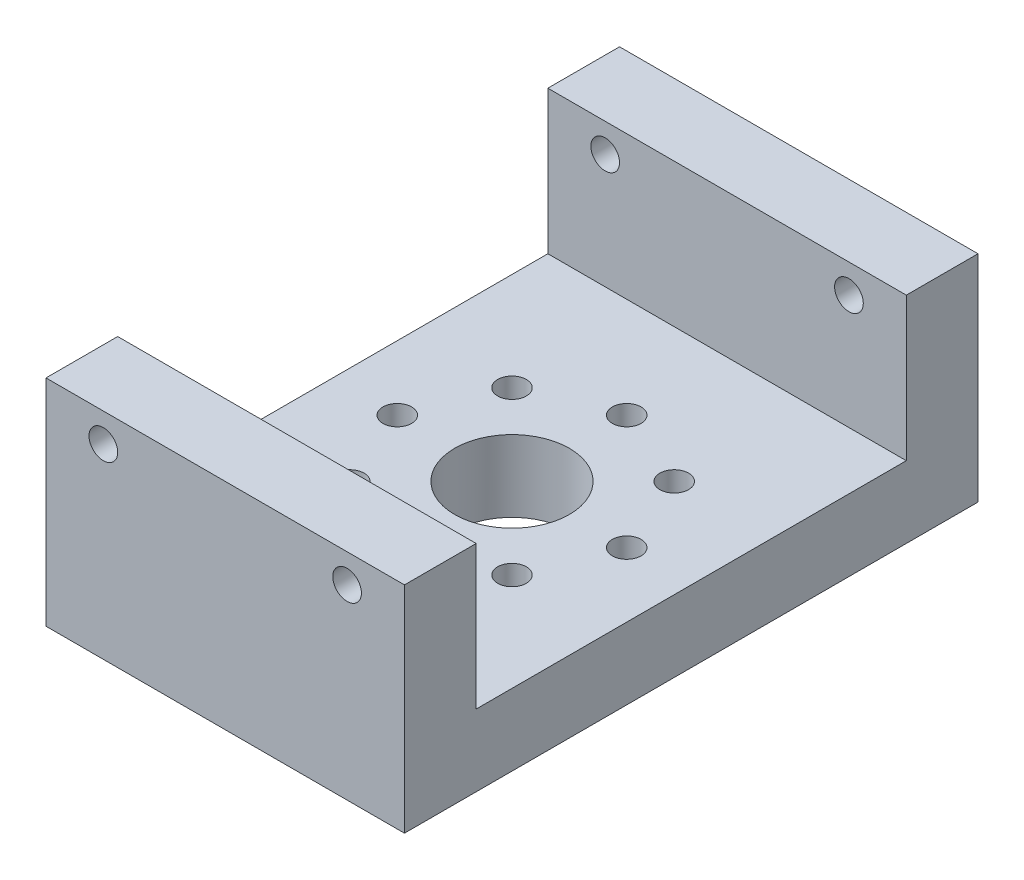
from build123d import *

# Parameters (mm, degrees)
SKETCH1_W           = 25
SKETCH1_H           = 40
BOSS_EXTRUDE1_DEPTH = 5
SKETCH5_W           = 25
SKETCH5_H           = 5
BOSS_EXTRUDE2_DEPTH = 10
SKETCH6_R           = 1
CUT_EXTRUDE3_DEPTH  = 45.511234537
SKETCH7_R           = 4
SKETCH7_R_2         = 1
CUT_EXTRUDE4_DEPTH  = 10


with BuildPart() as part:
    # Sketch1 → Boss-Extrude1 (new body)
    with BuildSketch(Plane(origin=(0, 0, 0), x_dir=(1, 0, 0), z_dir=(0, 1, 0))):
        Rectangle(SKETCH1_W, SKETCH1_H)
    extrude(amount=BOSS_EXTRUDE1_DEPTH)

    # Sketch5 → Boss-Extrude2 (add)
    with BuildSketch(Plane(origin=(0, 5, 0), x_dir=(1, 0, 0), z_dir=(0, 1, 0))):
        with Locations((0, 17.5)):
            Rectangle(SKETCH5_W, SKETCH5_H)
        with Locations((0, -17.5)):
            Rectangle(SKETCH5_W, SKETCH5_H)
    extrude(amount=BOSS_EXTRUDE2_DEPTH)

    # Sketch6 → Cut-Extrude3 (cut, through all)
    with BuildSketch(Plane.XY.offset(20)):
        with Locations((-8.5, 13)):
            Circle(SKETCH6_R)
        with Locations((8.5, 13)):
            Circle(SKETCH6_R)
    extrude(amount=-CUT_EXTRUDE3_DEPTH, mode=Mode.SUBTRACT)

    # Sketch7 → Cut-Extrude4 (cut)
    with BuildSketch(Plane.XZ):
        Circle(SKETCH7_R)
        with Locations((8, 0)):
            Circle(SKETCH7_R_2)
        with Locations((5.656854249, 5.656854249)):
            Circle(SKETCH7_R_2)
        with Locations((5.656854249, -5.656854249)):
            Circle(SKETCH7_R_2)
        with Locations((0, 8)):
            Circle(SKETCH7_R_2)
        with Locations((0, -8)):
            Circle(SKETCH7_R_2)
        with Locations((-5.656854249, 5.656854249)):
            Circle(SKETCH7_R_2)
        with Locations((-5.656854249, -5.656854249)):
            Circle(SKETCH7_R_2)
        with Locations((-8, 0)):
            Circle(SKETCH7_R_2)
    extrude(amount=-CUT_EXTRUDE4_DEPTH, mode=Mode.SUBTRACT)


solid = part.part
